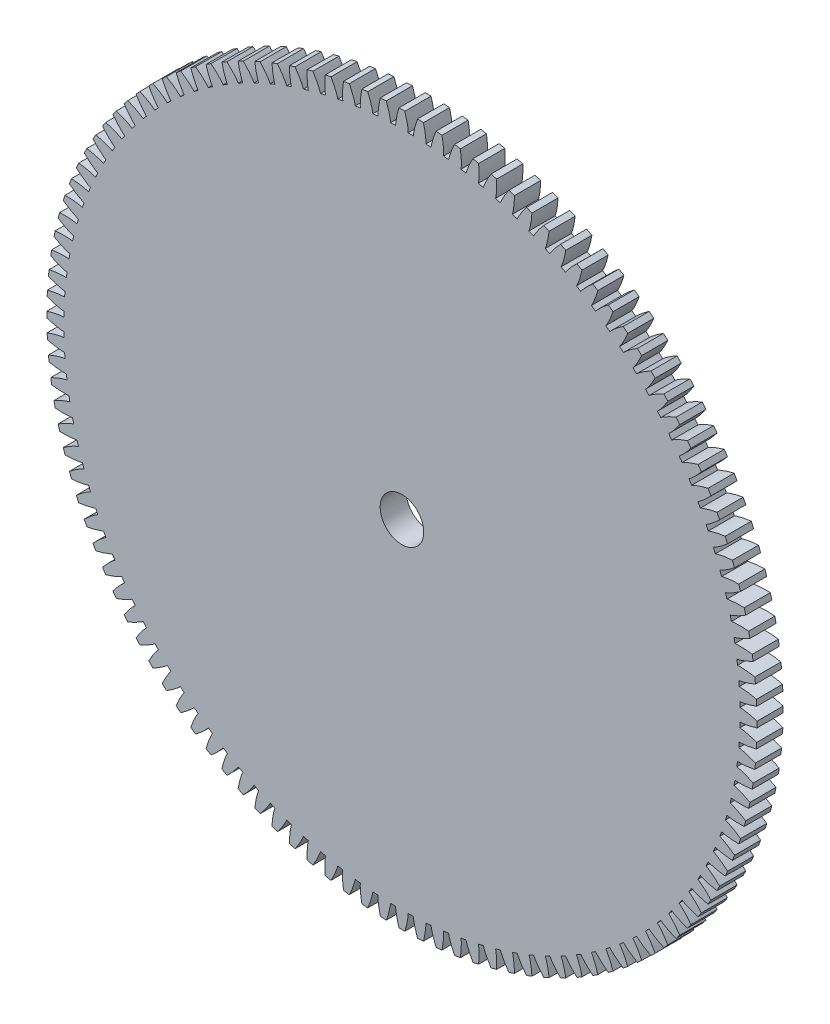
from build123d import *

# Parameters (mm, degrees)
SKETCH1_R           = 40.773684211
BOSS_EXTRUDE1_DEPTH = 3
CUT_EXTRUDE2_DEPTH  = 4
CIRPATTERN1_COUNT   = 120
BORE_DEPTH          = 5
BORE_DEPTH_BACK     = 5
BOREPROFILE_R       = 2.499999953


with BuildPart() as part:
    # Sketch1 → Boss-Extrude1 (new body)
    with BuildSketch(Plane.XY):
        Circle(SKETCH1_R)
    extrude(amount=BOSS_EXTRUDE1_DEPTH)

    # Sketch2 → Cut-Extrude2 (cut, symmetric)
    with BuildSketch(Plane.XY):
        with BuildLine():
            add(Edge.make_bspline(
                [(38.821074488, 0.723507182), (38.829347844, 0.723605262), (38.844998973, 0.723465642), (38.870559416, 0.722886151), (38.921047034, 0.720840836), (38.97820363, 0.71729549), (39.042887469, 0.712070728), (39.112555709, 0.705231096), (39.172222225, 0.698621772), (39.231843268, 0.691318116), (39.291330188, 0.68340074), (39.363507788, 0.673049533), (39.45022647, 0.659579083), (39.551857445, 0.642285494), (39.667456411, 0.620839976), (39.785663316, 0.597013129), (39.90231026, 0.571945712), (40.020580801, 0.544741363), (40.135309626, 0.517089628), (40.254946159, 0.486429227), (40.365609911, 0.457144224), (40.490152452, 0.422172653), (40.590818052, 0.393321073), (40.695299252, 0.361703017), (40.746225426, 0.346045927), (40.772283807, 0.337930862)],
                knots=[0, 0, 0, 0, 0, 0.015083688, 0.02853182, 0.04661014, 0.092110526, 0.119476176, 0.146842496, 0.174208854, 0.201574956, 0.228941013, 0.256307345, 0.307035032, 0.361767352, 0.416499661, 0.471231937, 0.525964282, 0.580696616, 0.635428982, 0.690161387, 0.744893688, 0.799626082, 0.854358407, 0.909090914, 0.909090914, 0.909090914, 0.909090914, 0.909090914], degree=4))
            Line((40.772283807, 0.337930862), (59.997939254, 0.497277891))
            add(Edge.make_bspline(
                [(59.997939254, 0.497277891), (59.997762721, 0.518577016), (59.99738986, 0.560060691), (59.996393061, 0.664567115), (59.995381809, 0.744521068), (59.99390127, 0.860121464), (59.992423546, 0.954281965), (59.990665516, 1.06137839), (59.988796095, 1.160669103), (59.986716857, 1.264630009), (59.984481052, 1.365844925), (59.982066985, 1.468568948), (59.979470379, 1.570617707), (59.976722607, 1.672662508), (59.973757206, 1.775372094), (59.970692767, 1.876565311), (59.967328262, 1.980492562), (59.963998647, 2.079745038), (59.960149273, 2.186786699), (59.956696993, 2.280895494), (59.952125445, 2.396414949), (59.948950845, 2.476312253), (59.944476834, 2.580727623), (59.942678097, 2.622173961), (59.941739677, 2.643453134)],
                knots=[0.083333333, 0.083333333, 0.083333333, 0.083333333, 0.083333333, 0.123015873, 0.162698413, 0.202380952, 0.242063492, 0.281746032, 0.321428571, 0.361111111, 0.400793651, 0.44047619, 0.48015873, 0.51984127, 0.55952381, 0.599206349, 0.638888889, 0.678571429, 0.718253968, 0.757936508, 0.797619048, 0.837301587, 0.876984127, 0.916666667, 0.916666667, 0.916666667, 0.916666667, 0.916666667], degree=4))
            Line((59.941739677, 2.643453134), (40.734092744, 1.796388722))
            add(Edge.make_bspline(
                [(38.805736995, 1.309222415), (38.814004145, 1.309557464), (38.829626518, 1.310516009), (38.855121603, 1.312432436), (38.905432986, 1.317117266), (38.962325702, 1.323649098), (39.026647452, 1.33225199), (39.095862255, 1.342728403), (39.155101094, 1.352451373), (39.214258185, 1.362865344), (39.273249217, 1.373885175), (39.344786159, 1.387999679), (39.430681007, 1.405990174), (39.531267625, 1.428579016), (39.645585794, 1.456045127), (39.7623837, 1.486025791), (39.877558856, 1.517163684), (39.994243546, 1.550520552), (40.107367959, 1.584138834), (40.225235893, 1.621018508), (40.334215326, 1.65605507), (40.456756915, 1.697496767), (40.555774581, 1.731577237), (40.658457832, 1.768620085), (40.708494785, 1.786920988), (40.734092744, 1.796388722)],
                knots=[0, 0, 0, 0, 0, 0.015083688, 0.02853182, 0.04661014, 0.092110526, 0.119476176, 0.146842496, 0.174208854, 0.201574956, 0.228941013, 0.256307345, 0.307035032, 0.361767352, 0.416499661, 0.471231937, 0.525964282, 0.580696616, 0.635428982, 0.690161387, 0.744893688, 0.799626082, 0.854358407, 0.909090914, 0.909090914, 0.909090914, 0.909090914, 0.909090914], degree=4))
            Line((38.805736995, 1.309222415), (38.821074488, 0.723507182))
        make_face()
    cut_extrude2 = extrude(amount=CUT_EXTRUDE2_DEPTH, both=True, mode=Mode.SUBTRACT)

    # CirPattern1: Cut-Extrude2 ×120 about axis
    cirpattern1_axis = Axis((0, 0, -0.15), (0, 0, 1))
    for i in range(1, CIRPATTERN1_COUNT):
        add(cut_extrude2.rotate(cirpattern1_axis, i * 360 / CIRPATTERN1_COUNT), mode=Mode.SUBTRACT)

    # BoreProfile → Bore (cut, two sides: drawn at the far end of the back side and taken through both)
    with BuildSketch(Plane.XY.offset(-BORE_DEPTH_BACK)):
        Circle(BOREPROFILE_R)
    extrude(amount=BORE_DEPTH + BORE_DEPTH_BACK, mode=Mode.SUBTRACT)


solid = part.part
